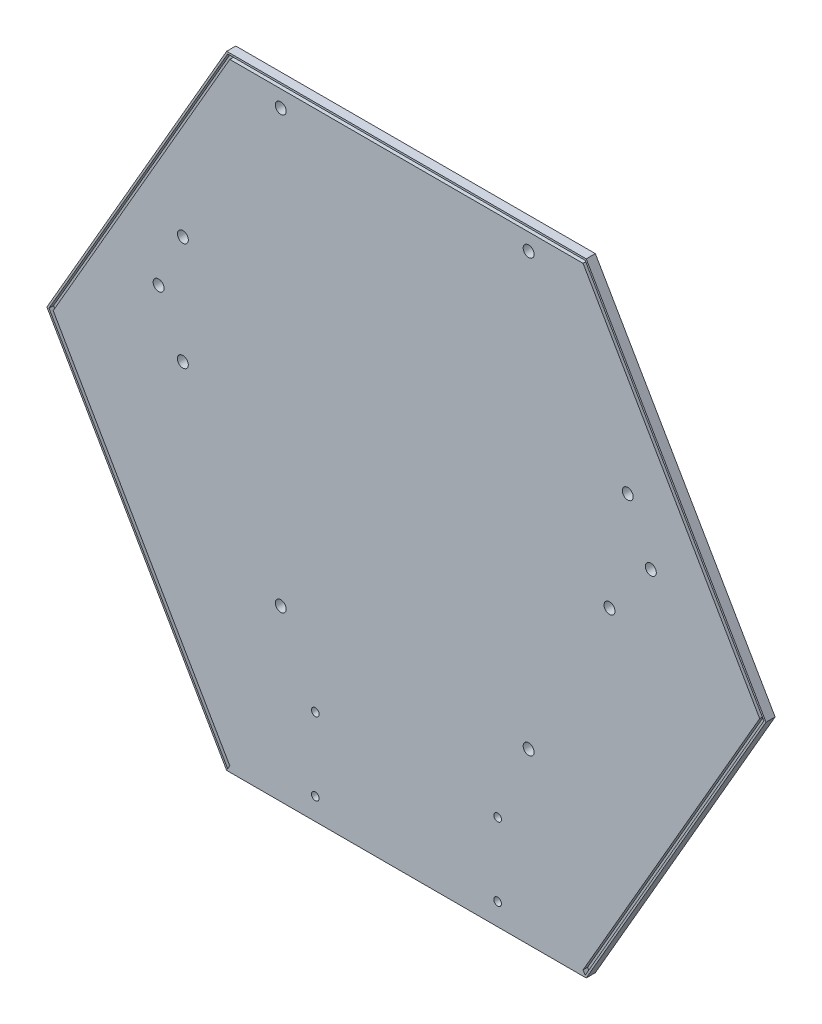
from build123d import *

# Parameters (mm, degrees)
EXTRUDE_9_DEPTH      = 5
CUT_EXTRUDE_7_DEPTH  = 2.5
SKETCH_53_R          = 3
CUT_EXTRUDE_12_DEPTH = 5
SKETCH_54_R          = 2.1
CUT_EXTRUDE_14_DEPTH = 291.088033153


with BuildPart() as part:
    # 草图51 → 凸台-拉伸9 (new body)
    with BuildSketch(Plane.XY.offset(20)):
        Polygon((198.176593222, -40.983726982), (99.565497293, 129.815701356), (-97.656694564, 129.815701356), (-196.267790492, -40.983726982), (-97.656694564, -211.78315532), (99.565497293, -211.78315532), align=None)
    extrude(amount=EXTRUDE_9_DEPTH)

    # 草图52 → 切除-拉伸7 (cut)
    with BuildSketch(Plane.XY.offset(25)):
        Polygon((-195.113089954, -40.983726982), (-97.079344294, 128.815701356), (98.988147024, 128.815701356), (197.021892683, -40.983726982), (98.988147024, -210.78315532), (97.833446486, -208.78315532), (194.712491607, -40.983726982), (97.833446486, 126.815701356), (-95.924643756, 126.815701356), (-192.803688877, -40.983726982), (-95.924643756, -208.78315532), (-97.079344294, -210.78315532), align=None)
    extrude(amount=-CUT_EXTRUDE_7_DEPTH, mode=Mode.SUBTRACT)

    # 草图53 → 切除-拉伸12 (cut)
    with BuildSketch(Plane(origin=(0, 0, 20), x_dir=(-1, 0, 0), z_dir=(0, 0, -1))):
        with Locations((-67.98, -118.86)):
            Circle(SKETCH_53_R)
        with Locations((-67.98, 117.66)):
            Circle(SKETCH_53_R)
        with Locations((67.98, 117.66)):
            Circle(SKETCH_53_R)
        with Locations((-112.33, -29.68)):
            Circle(SKETCH_53_R)
        with Locations((121.69, -29.68)):
            Circle(SKETCH_53_R)
        with Locations((-135, 0)):
            Circle(SKETCH_53_R)
        with Locations((135, 0)):
            Circle(SKETCH_53_R)
        with Locations((-122.33, 29.64)):
            Circle(SKETCH_53_R)
        with Locations((121.69, 29.64)):
            Circle(SKETCH_53_R)
        with Locations((67.98, -118.86)):
            Circle(SKETCH_53_R)
    extrude(amount=-CUT_EXTRUDE_12_DEPTH, mode=Mode.SUBTRACT)

    # 草图54 → 切除-拉伸14 (cut, through all)
    with BuildSketch(Plane.XY.offset(20)):
        with Locations((-49.045598635, -199.78315532)):
            Circle(SKETCH_54_R)
        with Locations((50.954401365, -199.78315532)):
            Circle(SKETCH_54_R)
        with Locations((-49.045598635, -159.78315532)):
            Circle(SKETCH_54_R)
        with Locations((50.954401365, -159.78315532)):
            Circle(SKETCH_54_R)
    extrude(amount=CUT_EXTRUDE_14_DEPTH, mode=Mode.SUBTRACT)


solid = part.part
